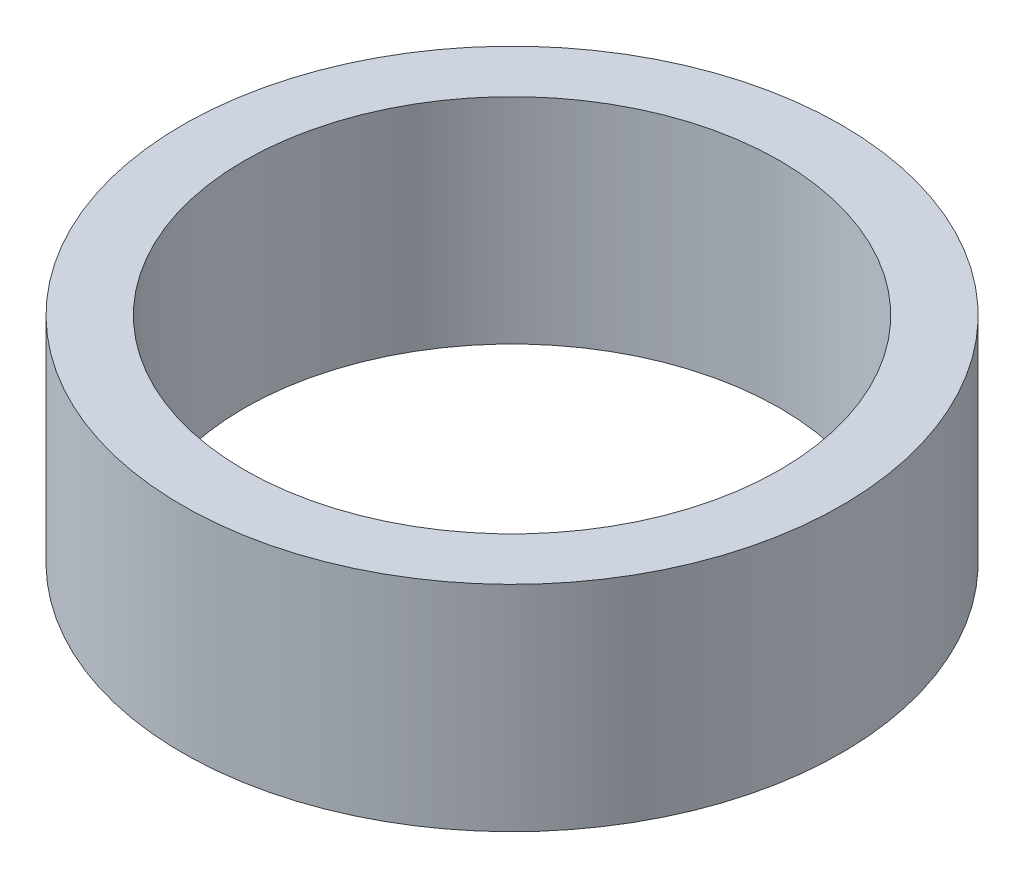
from build123d import *

# Parameters (mm, degrees)
SKETCH1_R           = 40
BOSS_EXTRUDE1_DEPTH = 26
SKETCH2_R           = 32.5
CUT_EXTRUDE1_DEPTH  = 63.257529665


with BuildPart() as part:
    # Sketch1 → Boss-Extrude1 (new body)
    with BuildSketch(Plane(origin=(0, 0, 0), x_dir=(1, 0, 0), z_dir=(0, 1, 0))):
        Circle(SKETCH1_R)
    extrude(amount=BOSS_EXTRUDE1_DEPTH)

    # Sketch2 → Cut-Extrude1 (cut, through all)
    with BuildSketch(Plane(origin=(0, 0, 0), x_dir=(1, 0, 0), z_dir=(0, 1, 0))):
        Circle(SKETCH2_R)
    extrude(amount=CUT_EXTRUDE1_DEPTH, mode=Mode.SUBTRACT)


solid = part.part
